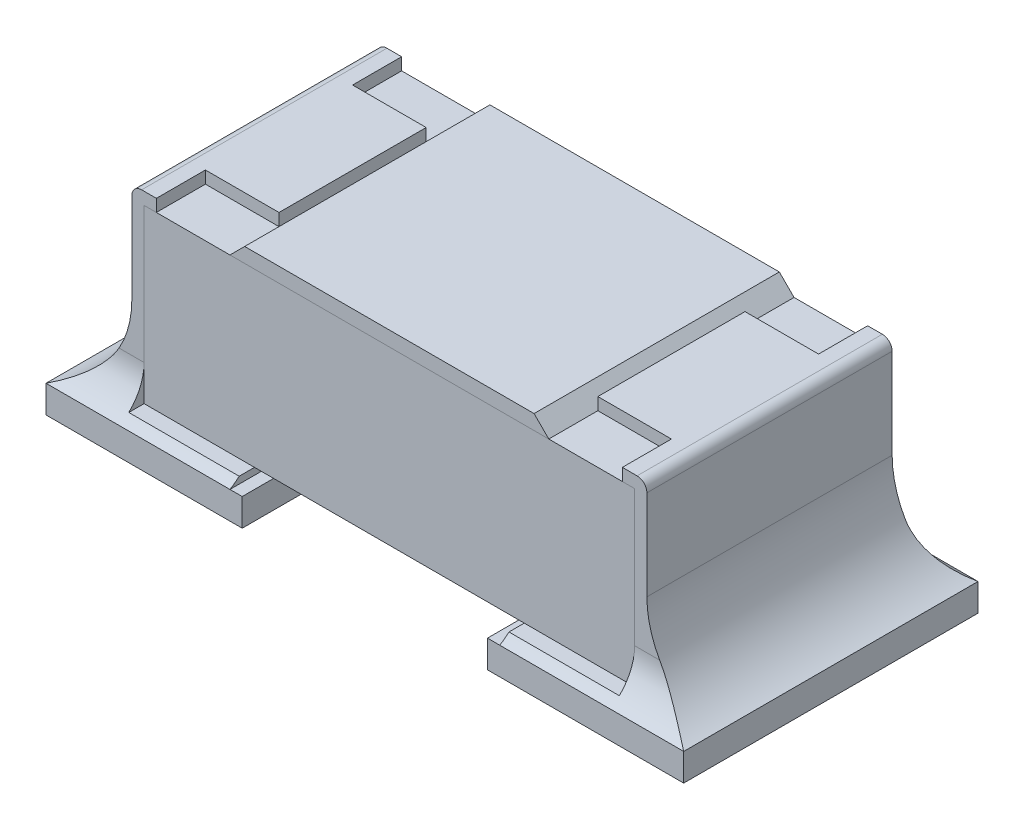
from build123d import *

# Parameters (mm, degrees)
SKETCH1_W             = 0.5
SKETCH1_H             = 0.35
BOSS_EXTRUDE1_DEPTH   = 0.5
BOSS_EXTRUDE2_DEPTH   = 0.25
BOSS_EXTRUDE2_2_DEPTH = 0.25
SKETCH3_W             = 0.15
SKETCH3_H             = 0.1
CUT_EXTRUDE1_DEPTH    = 0.025
BOSS_EXTRUDE3_DEPTH   = 0.25
SKETCH7_W             = 0.4
SKETCH7_H             = 0.6
BOSS_EXTRUDE5_DEPTH   = 0.056
FILLET3_R             = 0.2
FILLET4_R             = 0.2
FILLET5_R             = 0.1
FILLET6_R             = 0.1


with BuildPart() as part:
    # Sketch1 → Boss-Extrude1 (new, symmetric)
    with BuildSketch(Plane(origin=(0, 0, 0), x_dir=(0, 0, -1), z_dir=(1, 0, 0))):
        with Locations((0, 0.245)):
            Rectangle(SKETCH1_W, SKETCH1_H)
    extrude(amount=BOSS_EXTRUDE1_DEPTH, both=True)


with BuildPart() as body_2:
    # Sketch2 → Boss-Extrude2 (new, symmetric)
    with BuildSketch(Plane.XY):
        with BuildLine():
            Line((-0.325, 0.445), (-0.505, 0.445))
            ThreePointArc((-0.505, 0.445), (-0.519142136, 0.439142136), (-0.525, 0.425))
            Line((-0.525, 0.425), (-0.525, 0.045))
            Line((-0.525, 0.045), (-0.275, 0.045))
            Line((-0.275, 0.045), (-0.275, 0.07))
            Line((-0.275, 0.07), (-0.5, 0.07))
            Line((-0.5, 0.07), (-0.5, 0.42))
            Line((-0.5, 0.42), (-0.325, 0.42))
            Line((-0.325, 0.42), (-0.325, 0.445))
        make_face()
    extrude(amount=BOSS_EXTRUDE2_DEPTH, both=True)


with BuildPart() as body_3:
    # Sketch2 → Boss-Extrude2 2 (new, symmetric)
    with BuildSketch(Plane.XY):
        with BuildLine():
            Line((0.325, 0.42), (0.325, 0.445))
            Line((0.325, 0.445), (0.505, 0.445))
            ThreePointArc((0.505, 0.445), (0.519142136, 0.439142136), (0.525, 0.425))
            Line((0.525, 0.425), (0.525, 0.045))
            Line((0.525, 0.045), (0.275, 0.045))
            Line((0.275, 0.045), (0.275, 0.07))
            Line((0.275, 0.07), (0.5, 0.07))
            Line((0.5, 0.07), (0.5, 0.42))
            Line((0.5, 0.42), (0.325, 0.42))
        make_face()
    extrude(amount=BOSS_EXTRUDE2_2_DEPTH, both=True)


with BuildPart() as cut_extrude1_tool:
    # Sketch3 → Cut-Extrude1 (new body)
    with BuildSketch(Plane(origin=(0, 0.445, 0), x_dir=(1, 0, 0), z_dir=(0, 1, 0))):
        with Locations((-0.4, 0.2)):
            Rectangle(SKETCH3_W, SKETCH3_H)
        with Locations((-0.4, -0.2)):
            Rectangle(SKETCH3_W, SKETCH3_H)
        with Locations((0.4, -0.2)):
            Rectangle(SKETCH3_W, SKETCH3_H)
        with Locations((0.4, 0.2)):
            Rectangle(SKETCH3_W, SKETCH3_H)
    extrude(amount=-CUT_EXTRUDE1_DEPTH)


with BuildPart() as body_2_1:
    add(body_2.part)

    # Cut-Extrude1: cut by cut_extrude1_tool
    add(cut_extrude1_tool.part, mode=Mode.SUBTRACT)



with BuildPart() as body_3_1:
    add(body_3.part)

    # Cut-Extrude1: cut by cut_extrude1_tool
    add(cut_extrude1_tool.part, mode=Mode.SUBTRACT)


with BuildPart() as body_4:
    # Sketch4 → Boss-Extrude3 (new, symmetric)
    with BuildSketch(Plane.XY):
        Polygon((-0.325, 0.42), (0.325, 0.42), (0.295, 0.45), (-0.295, 0.45), align=None)
    extrude(amount=BOSS_EXTRUDE3_DEPTH, both=True)


with BuildPart() as body_2_2:
    add(body_2_1.part)

    add(body_3_1.part)  # Boss-Extrude5 merges body 3
    # Sketch7 → Boss-Extrude5 (add)
    with BuildSketch(Plane(origin=(0, 0, 0), x_dir=(1, 0, 0), z_dir=(0, 1, 0))):
        with Locations((-0.45, 0)):
            Rectangle(SKETCH7_W, SKETCH7_H)
        with Locations((0.45, 0)):
            Rectangle(SKETCH7_W, SKETCH7_H)
    extrude(amount=BOSS_EXTRUDE5_DEPTH)

    # Fillet3
    # the kernel refuses this fillet: 0.2 mm, written as the material it adds along each edge
    with BuildSketch(Plane(origin=(-0.525, 0.056, -0.25), x_dir=(-1, 0, 0), z_dir=(0, 0, 1))) as fillet3_piece_1:
        with BuildLine():
            CenterArc((0.2, -0.185404962), FILLET3_R, 112.024312837, 67.975687163)
            Line((0, -0.185404962), (-0.004, -0.185404962))
            Line((-0.004, -0.185404962), (-0.004, 0))
            Line((-0.004, 0), (0, 0.004))
            ThreePointArc((0, 0.004), (0.0625, 0.004), (0.1235, 0.003708099))
            Line((0.1235, 0.003708099), (0.125, 0))
        make_face()
    extrude(amount=0.5)

    # Fillet4
    # the kernel refuses this fillet: 0.2 mm, written as the material it adds along each edge
    with BuildSketch(Plane(origin=(0.525, 0.056, 0.25), x_dir=(1, 0, 0), z_dir=(0, 0, -1))) as fillet4_piece_1:
        with BuildLine():
            CenterArc((0.2, -0.185404962), FILLET4_R, 112.024312837, 67.975687163)
            Line((0, -0.185404962), (-0.004, -0.185404962))
            Line((-0.004, -0.185404962), (-0.004, 0))
            Line((-0.004, 0), (0, 0.004))
            ThreePointArc((0, 0.004), (0.0625, 0.004), (0.1235, 0.003708099))
            Line((0.1235, 0.003708099), (0.125, 0))
        make_face()
    extrude(amount=0.5)

    # Fillet5
    # the kernel refuses this fillet: 0.1 mm, written as the material it adds along each edge
    with BuildSketch(Plane(origin=(0.65, 0.056, -0.25), x_dir=(0, 1, 0), z_dir=(-1, 0, 0))) as fillet5_piece_1_section:
        with BuildLine():
            CenterArc((0.08660254, 0.1), FILLET5_R, 210, 60)
            Line((0, 0.05), (0, 0))
            Line((0, 0), (0.08660254, 0))
        make_face()
    fillet5_piece_1 = extrude(amount=0.591506351, mode=Mode.PRIVATE)
    fillet5_piece_1 = fillet5_piece_1 - Plane(origin=(0.725, 0.241404962, -0.25), x_dir=(1, 0, 0), z_dir=(0, 0, 1)) * Cylinder(0.2, 2, mode=Mode.PRIVATE)
    fillet5_piece_1 = split(fillet5_piece_1, bisect_by=Plane(origin=(0.5, 0.056, -0.25), z_dir=(1, 0, 0)), keep=Keep.TOP, mode=Mode.PRIVATE)
    add(fillet5_piece_1)
    with BuildSketch(Plane(origin=(0.866506351, 0.056, -0.25), x_dir=(0, 1, 0), z_dir=(-1, 0, 0))) as fillet5_piece_2_section:
        with BuildLine():
            CenterArc((0.08660254, 0.1), FILLET5_R, 210, 60)
            Line((0, 0.05), (0, 0))
            Line((0, 0), (0.08660254, 0))
        make_face()
    fillet5_piece_2 = extrude(amount=0.591506351, mode=Mode.PRIVATE)
    fillet5_piece_2 = split(fillet5_piece_2, bisect_by=Plane(origin=(0.866506351, 0.07, -0.25), z_dir=(0, -1, 0)), keep=Keep.TOP, mode=Mode.PRIVATE)
    fillet5_piece_2 = split(fillet5_piece_2, bisect_by=Plane(origin=(0.5, 0.056, -0.25), z_dir=(-1, 0, 0)), keep=Keep.TOP, mode=Mode.PRIVATE)
    add(fillet5_piece_2)
    with BuildSketch(Plane(origin=(0.275, 0.056, 0.25), x_dir=(0, 2.031291801430194e-12, 1.0), z_dir=(1, 0, 0))) as fillet5_piece_3_section:
        with BuildLine():
            CenterArc((0.1, -0.08660254), FILLET5_R, 120, 60)
            Line((0, -0.08660254), (0, 0))
            Line((0, 0), (0.05, 0))
        make_face()
    fillet5_piece_3 = extrude(amount=0.375, mode=Mode.PRIVATE)
    fillet5_piece_3 = fillet5_piece_3 - Plane(origin=(0.725, 0.241404962, 0.25), x_dir=(1, 0, 0), z_dir=(0, 0, 1)) * Cylinder(0.2, 2, mode=Mode.PRIVATE)
    fillet5_piece_3 = split(fillet5_piece_3, bisect_by=Plane(origin=(0.275, 0.07, 0.25), z_dir=(0, -1, 0)), keep=Keep.TOP, mode=Mode.PRIVATE)
    add(fillet5_piece_3)
    with BuildSketch(Plane(origin=(0.058493649, 0.056, 0.25), x_dir=(0, 2.031291801430194e-12, 1.0), z_dir=(1, 0, 0))) as fillet5_piece_4_section:
        with BuildLine():
            CenterArc((0.1, -0.08660254), FILLET5_R, 120, 60)
            Line((0, -0.08660254), (0, 0))
            Line((0, 0), (0.05, 0))
        make_face()
    fillet5_piece_4 = extrude(amount=0.591506351, mode=Mode.PRIVATE)
    fillet5_piece_4 = fillet5_piece_4 - Plane(origin=(0.725, 0.241404962, 0.25), x_dir=(1, 0, 0), z_dir=(0, 0, 1)) * Cylinder(0.2, 2, mode=Mode.PRIVATE)
    fillet5_piece_4 = split(fillet5_piece_4, bisect_by=Plane(origin=(0.5, 0.056, 0.25), z_dir=(1, 0, 0)), keep=Keep.TOP, mode=Mode.PRIVATE)
    add(fillet5_piece_4)

    # Fillet6
    # the kernel refuses this fillet: 0.1 mm, written as the material it adds along each edge
    with BuildSketch(Plane(origin=(-0.65, 0.056, 0.25), x_dir=(0, 1, 0), z_dir=(1, 0, 0))) as fillet6_piece_1_section:
        with BuildLine():
            CenterArc((0.08660254, 0.1), FILLET6_R, 210, 60)
            Line((0, 0.05), (0, 0))
            Line((0, 0), (0.08660254, 0))
        make_face()
    fillet6_piece_1 = extrude(amount=0.591506351, mode=Mode.PRIVATE)
    fillet6_piece_1 = fillet6_piece_1 - Plane(origin=(-0.725, 0.241404962, 0.25), x_dir=(-1, 0, 0), z_dir=(0, 0, -1)) * Cylinder(0.2, 2, mode=Mode.PRIVATE)
    fillet6_piece_1 = split(fillet6_piece_1, bisect_by=Plane(origin=(-0.5, 0.056, 0.25), z_dir=(-1, 0, 0)), keep=Keep.TOP, mode=Mode.PRIVATE)
    add(fillet6_piece_1)
    with BuildSketch(Plane(origin=(-0.866506351, 0.056, 0.25), x_dir=(0, 1, 0), z_dir=(1, 0, 0))) as fillet6_piece_2_section:
        with BuildLine():
            CenterArc((0.08660254, 0.1), FILLET6_R, 210, 60)
            Line((0, 0.05), (0, 0))
            Line((0, 0), (0.08660254, 0))
        make_face()
    fillet6_piece_2 = extrude(amount=0.591506351, mode=Mode.PRIVATE)
    fillet6_piece_2 = split(fillet6_piece_2, bisect_by=Plane(origin=(-0.866506351, 0.07, 0.25), z_dir=(0, -1, 0)), keep=Keep.TOP, mode=Mode.PRIVATE)
    fillet6_piece_2 = split(fillet6_piece_2, bisect_by=Plane(origin=(-0.5, 0.056, 0.25), z_dir=(1, 0, 0)), keep=Keep.TOP, mode=Mode.PRIVATE)
    add(fillet6_piece_2)
    with BuildSketch(Plane(origin=(-0.275, 0.056, -0.25), x_dir=(0, 2.0315693571863432e-12, -1.0), z_dir=(-1, 0, 0))) as fillet6_piece_3_section:
        with BuildLine():
            CenterArc((0.1, -0.08660254), FILLET6_R, 120, 60)
            Line((0, -0.08660254), (0, 0))
            Line((0, 0), (0.05, 0))
        make_face()
    fillet6_piece_3 = extrude(amount=0.375, mode=Mode.PRIVATE)
    fillet6_piece_3 = fillet6_piece_3 - Plane(origin=(-0.725, 0.241404962, -0.25), x_dir=(-1, 0, 0), z_dir=(0, 0, -1)) * Cylinder(0.2, 2, mode=Mode.PRIVATE)
    fillet6_piece_3 = split(fillet6_piece_3, bisect_by=Plane(origin=(-0.275, 0.07, -0.25), z_dir=(0, -1, 0)), keep=Keep.TOP, mode=Mode.PRIVATE)
    add(fillet6_piece_3)
    with BuildSketch(Plane(origin=(-0.058493649, 0.056, -0.25), x_dir=(0, 2.0315693571863432e-12, -1.0), z_dir=(-1, 0, 0))) as fillet6_piece_4_section:
        with BuildLine():
            CenterArc((0.1, -0.08660254), FILLET6_R, 120, 60)
            Line((0, -0.08660254), (0, 0))
            Line((0, 0), (0.05, 0))
        make_face()
    fillet6_piece_4 = extrude(amount=0.591506351, mode=Mode.PRIVATE)
    fillet6_piece_4 = fillet6_piece_4 - Plane(origin=(-0.725, 0.241404962, -0.25), x_dir=(-1, 0, 0), z_dir=(0, 0, -1)) * Cylinder(0.2, 2, mode=Mode.PRIVATE)
    fillet6_piece_4 = split(fillet6_piece_4, bisect_by=Plane(origin=(-0.5, 0.056, -0.25), z_dir=(-1, 0, 0)), keep=Keep.TOP, mode=Mode.PRIVATE)
    add(fillet6_piece_4)


solid = Compound([part.part, body_4.part, body_2_2.part])
